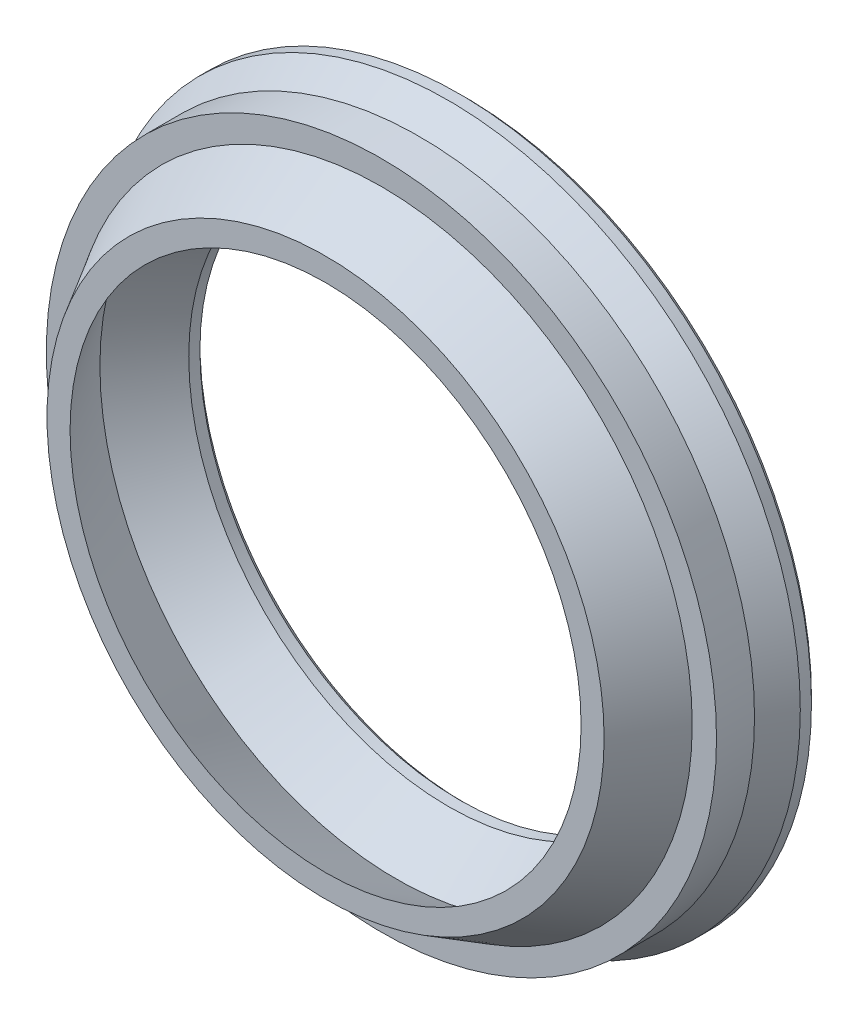
from build123d import *

# Parameters (mm, degrees)
ENDCHAMFER_SIZE = 0.333333333


with BuildPart() as part:
    # Sketch1 → Body (revolve)
    with BuildSketch(Plane(origin=(21, 0, -3.148731764), x_dir=(-1, 0, 0), z_dir=(0, 1, 0))):
        Polygon((41, -2.452550761), (41, -0.184601569), (39.549500897, -0.184601569), (37.625, 3.148731764), (36.25, 3.148731764), (38.683508392, -1.066228411), (36.5, -4.184601569), (36.5, -5.184601569), (42, -5.184601569), (42, -4.184601569), align=None)
    revolve(axis=Axis((0, 0, 7.495368479), (0, 0, -1)))

    # Sketch2 → Cut-Revolve1 (revolve, cut)
    with BuildSketch(Plane(origin=(19.25, 0, -11.337430168), x_dir=(-1, 0, 0), z_dir=(0, 1, 0))):
        Polygon((2, 3.004096834), (0, 3.004096834), (0.461880215, 3.804096834), (1.538119785, 3.804096834), align=None)
    revolve(axis=Axis((0, 0, 2.510986965), (0, 0, -1)), mode=Mode.SUBTRACT)

    # EndChamfer
    endchamfer_edges = [part.edges().sort_by_distance(p)[0] for p in [
        (15.5, 0, -8.333333333),
        (21, 0, -8.333333333),
    ]]
    chamfer(endchamfer_edges, length=ENDCHAMFER_SIZE)


solid = part.part
